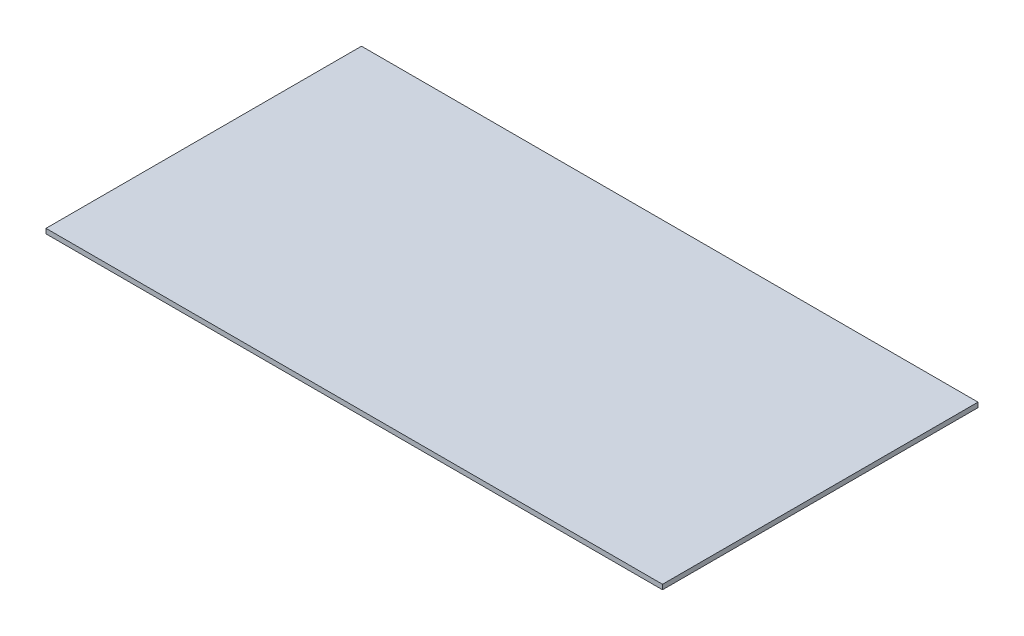
from build123d import *

# Parameters (mm, degrees)
SKETCH1_W           = 812.8
SKETCH1_H           = 415.925
BOSS_EXTRUDE1_DEPTH = 6.35


with BuildPart() as part:
    # Sketch1 → Boss-Extrude1 (new body)
    with BuildSketch(Plane(origin=(0, 0, 0), x_dir=(1, 0, 0), z_dir=(0, 1, 0))):
        with Locations((406.4, 207.9625)):
            Rectangle(SKETCH1_W, SKETCH1_H)
    extrude(amount=BOSS_EXTRUDE1_DEPTH)


solid = part.part
